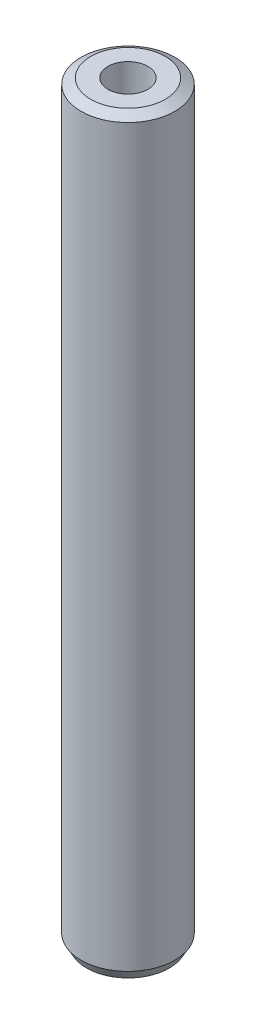
from build123d import *
from OCP.BRepFilletAPI import BRepFilletAPI_MakeChamfer

# Parameters (mm, degrees)
SKETCH1_R           = 37.5
BOSS_EXTRUDE1_DEPTH = 600
SKETCH2_R           = 15.956571614
CUT_EXTRUDE1_DEPTH  = 603.339190158
CHAMFER1_SIZE       = 4.452814927
CHAMFER1_SIZE2      = 7.71250169


with BuildPart() as part:
    # Sketch1 → Boss-Extrude1 (new body)
    with BuildSketch(Plane(origin=(0, 0, 0), x_dir=(1, 0, 0), z_dir=(0, 1, 0))):
        Circle(SKETCH1_R)
    extrude(amount=BOSS_EXTRUDE1_DEPTH)

    # Sketch2 → Cut-Extrude1 (cut, through all)
    with BuildSketch(Plane(origin=(0, 0, 0), x_dir=(1, 0, 0), z_dir=(0, 1, 0))):
        Circle(SKETCH2_R)
    extrude(amount=CUT_EXTRUDE1_DEPTH, mode=Mode.SUBTRACT)

    # Chamfer1: one chamfer whose edges measure the first distance from different faces: ONE call of the kernel's chamfer builder (chamfer() names one face for all edges)
    chamfer1_edges_1 = [part.edges().sort_by_distance(p)[0] for p in [
        (-37.5, 600, 0),
    ]]
    chamfer1_side_1 = [part.faces().sort_by_distance(p)[0] for p in [
        (-37.5, 300, 0),
    ]]
    chamfer1_edges_2 = [part.edges().sort_by_distance(p)[0] for p in [
        (-37.5, 0, 0),
    ]]
    chamfer1_side_2 = [part.faces().sort_by_distance(p)[0] for p in [
        (-36.439339828, 0, 0),
    ]]
    chamfer1 = BRepFilletAPI_MakeChamfer(part.part.solid().wrapped)
    for e in chamfer1_edges_1:
        chamfer1.Add(CHAMFER1_SIZE, CHAMFER1_SIZE2, e.wrapped, chamfer1_side_1[0].wrapped)  # the first distance lies on this face
    for e in chamfer1_edges_2:
        chamfer1.Add(CHAMFER1_SIZE, CHAMFER1_SIZE2, e.wrapped, chamfer1_side_2[0].wrapped)  # the first distance lies on this face
    add(Compound.cast(chamfer1.Shape()), mode=Mode.REPLACE)


solid = part.part
